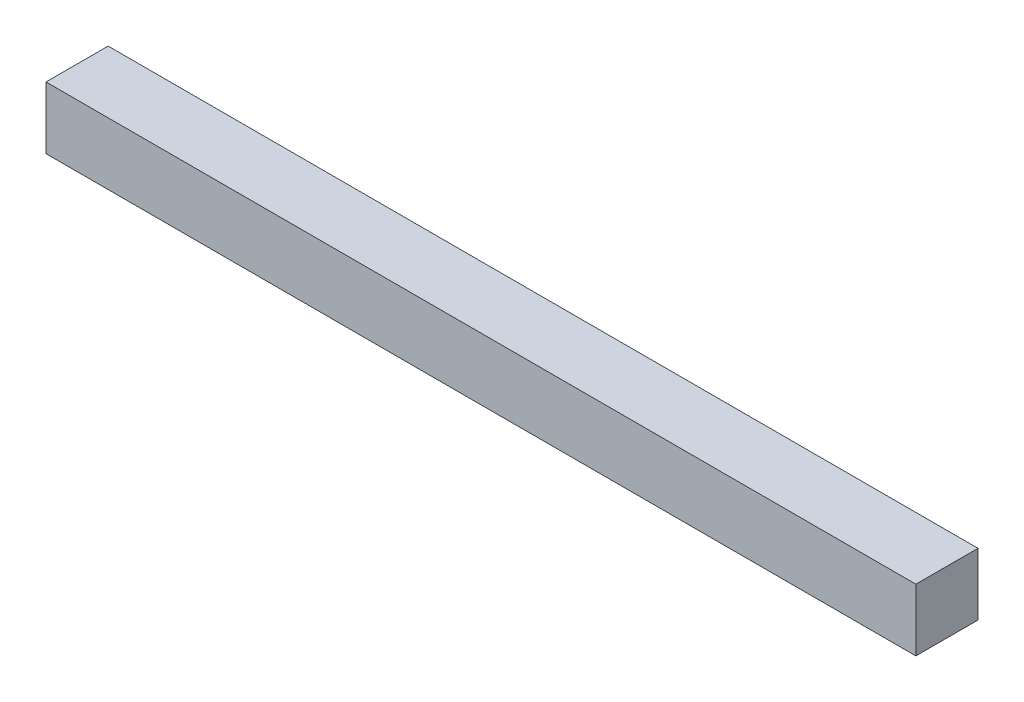
from build123d import *

# Parameters (mm, degrees)
SKETCH1_W           = 19.05
SKETCH1_H           = 19.05
BOSS_EXTRUDE1_DEPTH = 133.35


with BuildPart() as part:
    # Sketch1 → Boss-Extrude1 (new, symmetric)
    with BuildSketch(Plane(origin=(0, 0, 0), x_dir=(0, 0, -1), z_dir=(1, 0, 0))):
        Rectangle(SKETCH1_W, SKETCH1_H)
    extrude(amount=BOSS_EXTRUDE1_DEPTH, both=True)


solid = part.part
